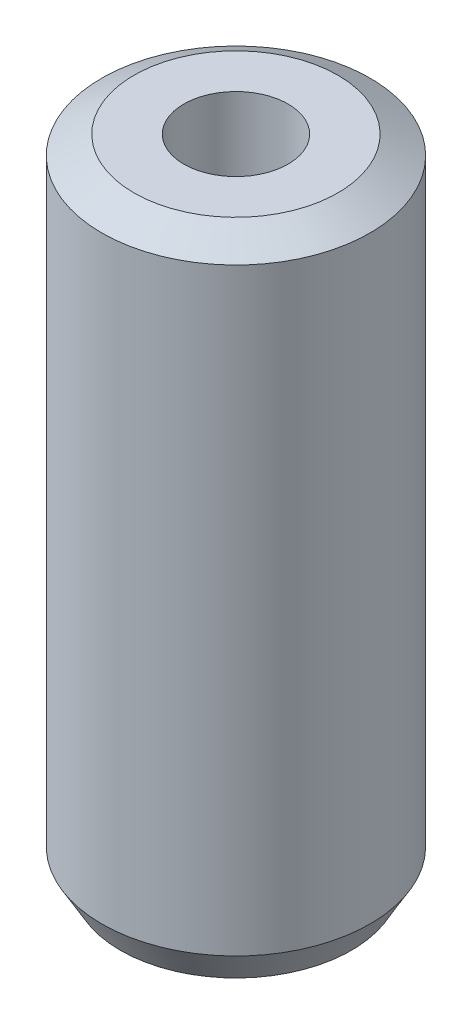
from build123d import *
from OCP.BRepFilletAPI import BRepFilletAPI_MakeChamfer

# Parameters (mm, degrees)
SKETCH1_R           = 42.5
BOSS_EXTRUDE1_DEPTH = 205.681038497
SKETCH2_R           = 16.515078969
CUT_EXTRUDE1_DEPTH  = 215.282966186
CHAMFER1_SIZE       = 5.885605207
CHAMFER1_SIZE2      = 10.194167252


with BuildPart() as part:
    # Sketch1 → Boss-Extrude1 (new body)
    with BuildSketch(Plane(origin=(0, 0, 0), x_dir=(1, 0, 0), z_dir=(0, 1, 0))):
        Circle(SKETCH1_R)
    extrude(amount=BOSS_EXTRUDE1_DEPTH)

    # Sketch2 → Cut-Extrude1 (cut, through all)
    with BuildSketch(Plane(origin=(0, 0, 0), x_dir=(1, 0, 0), z_dir=(0, 1, 0))):
        Circle(SKETCH2_R)
    extrude(amount=CUT_EXTRUDE1_DEPTH, mode=Mode.SUBTRACT)

    # Chamfer1: one chamfer whose edges measure the first distance from different faces: ONE call of the kernel's chamfer builder (chamfer() names one face for all edges)
    chamfer1_edges_1 = [part.edges().sort_by_distance(p)[0] for p in [
        (-42.5, 205.681038497, 0),
    ]]
    chamfer1_side_1 = [part.faces().sort_by_distance(p)[0] for p in [
        (-42.5, 102.840519249, 0),
    ]]
    chamfer1_edges_2 = [part.edges().sort_by_distance(p)[0] for p in [
        (-42.5, 0, 0),
    ]]
    chamfer1_side_2 = [part.faces().sort_by_distance(p)[0] for p in [
        (-41.297918472, 0, 0),
    ]]
    chamfer1 = BRepFilletAPI_MakeChamfer(part.part.solid().wrapped)
    for e in chamfer1_edges_1:
        chamfer1.Add(CHAMFER1_SIZE, CHAMFER1_SIZE2, e.wrapped, chamfer1_side_1[0].wrapped)  # the first distance lies on this face
    for e in chamfer1_edges_2:
        chamfer1.Add(CHAMFER1_SIZE, CHAMFER1_SIZE2, e.wrapped, chamfer1_side_2[0].wrapped)  # the first distance lies on this face
    add(Compound.cast(chamfer1.Shape()), mode=Mode.REPLACE)


solid = part.part
